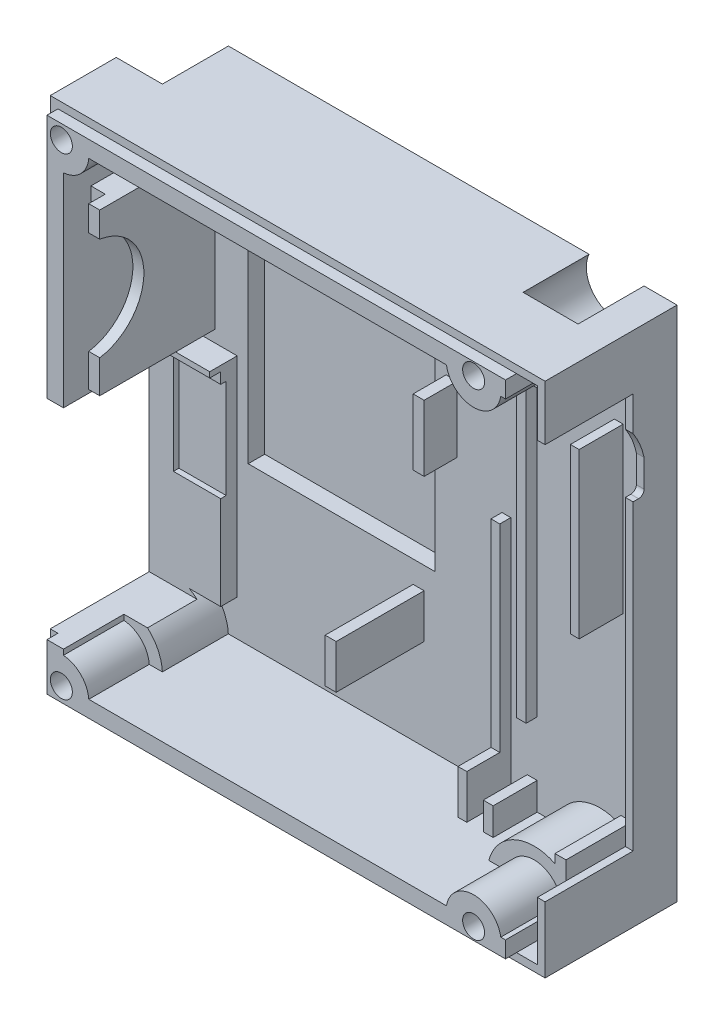
from build123d import *

# Parameters (mm, degrees)
SCHIZZO1_W                    = 45
SCHIZZO1_H                    = 47
ESTRUSIONE_ESTRUSIONE1_DEPTH  = 13
SCHIZZO2_W                    = 45
SCHIZZO2_H                    = 47
SCHIZZO2_W_2                  = 43.6
SCHIZZO2_H_2                  = 45.6
TAGLIO_ESTRUSIONE1_DEPTH      = 1
SCHIZZO3_W                    = 20
SCHIZZO3_H                    = 23
ESTRUSIONE_ESTRUSIONE2_DEPTH  = 1.5
SCHIZZO4_W                    = 5
SCHIZZO4_H                    = 16
TAGLIO_ESTRUSIONE2_DEPTH      = 1
SCHIZZO5_W                    = 5
SCHIZZO5_H                    = 7
TAGLIO_ESTRUSIONE3_DEPTH      = 1
TAGLIO_ESTRUSIONE4_DEPTH      = 6
TAGLIO_ESTRUSIONE7_DEPTH      = 34.38787205
TAGLIO_ESTRUSIONE7_DEPTH_BACK = 34.38787205
SCHIZZO7_R                    = 1
SVUOTA1_START                 = 1.5
SVUOTA1_DEPTH                 = 11.5
SVUOTA1_START_2               = 4
SVUOTA1_2_DEPTH               = 9
SVUOTA1_3_OUTLINE_W           = 17
SVUOTA1_3_OUTLINE_H           = 20
SVUOTA1_3_DEPTH               = 1.5
SVUOTA1_START_3               = 7.5
SVUOTA1_4_DEPTH               = 5.5
TAGLIO_ESTRUSIONE8_START      = -6.5
SCHIZZO8_W                    = 10
SCHIZZO8_H                    = 19
TAGLIO_ESTRUSIONE8_DEPTH      = 6.5
TAGLIO_ESTRUSIONE9_REACH      = 54.405
SCHIZZO9_W                    = 9
SCHIZZO9_H                    = 36
SCHIZZO10_W                   = 10
SCHIZZO10_H                   = 3
TAGLIO_ESTRUSIONE10_DEPTH     = 0.5
SCHIZZO11_W                   = 1
SCHIZZO11_H                   = 6
ESTRUSIONE_ESTRUSIONE3_DEPTH  = 3
SCHIZZO12_W                   = 1
SCHIZZO12_H                   = 4
ESTRUSIONE_ESTRUSIONE4_DEPTH  = 8
TAGLIO_ESTRUSIONE14_START     = -11.5
SCHIZZO15_W                   = 1.9
SCHIZZO15_H                   = 45.6
TAGLIO_ESTRUSIONE14_DEPTH     = 11.5
SCHIZZO13_W                   = 0.8
SCHIZZO13_H                   = 42.6
SCHIZZO13_W_2                 = 0.9
ESTRUSIONE_ESTRUSIONE5_DEPTH  = 4
TAGLIO_ESTRUSIONE15_DEPTH     = 1
TAGLIO_ESTRUSIONE16_DEPTH     = 1
SCHIZZO17_W                   = 4.3
SCHIZZO17_H                   = 9
TAGLIO_ESTRUSIONE17_DEPTH     = 0.5
SCHIZZO18_W                   = 1
SCHIZZO18_H                   = 1.5
SCHIZZO18_W_2                 = 0.8
SCHIZZO18_H_2                 = 14.918008703
ESTRUSIONE_ESTRUSIONE6_DEPTH  = 6
ESTRUSIONE_ESTRUSIONE7_DEPTH  = 10.5
TAGLIO_ESTRUSIONE18_REACH     = 38.478
SCHIZZO20_W                   = 1.3
SCHIZZO20_H                   = 1.5
TAGLIO_ESTRUSIONE19_DEPTH     = 1
TAGLIO_ESTRUSIONE20_REACH     = 54.405
TAGLIO_ESTRUSIONE21_REACH     = 51.516
SCHIZZO23_W                   = 2
SCHIZZO23_H                   = 14.918008703


# Read off the part's stored shape, not the designer's step: Svuota1
with BuildPart() as part:
    # Schizzo1 → Estrusione-Estrusione1 (new body)
    with BuildSketch(Plane.XY):
        Rectangle(SCHIZZO1_W, SCHIZZO1_H)
    extrude(amount=ESTRUSIONE_ESTRUSIONE1_DEPTH)

    # Schizzo2 → Taglio-Estrusione1 (cut)
    with BuildSketch(Plane.XY.offset(13)):
        Rectangle(SCHIZZO2_W, SCHIZZO2_H)
        Rectangle(SCHIZZO2_W_2, SCHIZZO2_H_2, mode=Mode.SUBTRACT)
    extrude(amount=-TAGLIO_ESTRUSIONE1_DEPTH, mode=Mode.SUBTRACT)

    # Schizzo3 → Estrusione-Estrusione2 (add)
    with BuildSketch(Plane(origin=(0, 0, 0), x_dir=(-1, 0, 0), z_dir=(0, 0, -1))):
        with Locations((6.5, 3)):
            Rectangle(SCHIZZO3_W, SCHIZZO3_H)
    extrude(amount=ESTRUSIONE_ESTRUSIONE2_DEPTH)

    # Schizzo4 → Taglio-Estrusione2 (cut)
    with BuildSketch(Plane(origin=(0, 0, 0), x_dir=(-1, 0, 0), z_dir=(0, 0, -1))):
        with Locations((20, -8.5)):
            Rectangle(SCHIZZO4_W, SCHIZZO4_H)
    extrude(amount=-TAGLIO_ESTRUSIONE2_DEPTH, mode=Mode.SUBTRACT)

    # Schizzo5 → Taglio-Estrusione3 (cut)
    with BuildSketch(Plane(origin=(0, 0, 1), x_dir=(-1, 0, 0), z_dir=(0, 0, -1))):
        with Locations((20, -13)):
            Rectangle(SCHIZZO5_W, SCHIZZO5_H)
    extrude(amount=-TAGLIO_ESTRUSIONE3_DEPTH, mode=Mode.SUBTRACT)

    # Schizzo6 → Taglio-Estrusione4 (cut)
    with BuildSketch(Plane(origin=(0, 0, 0), x_dir=(-1, 0, 0), z_dir=(0, 0, -1))):
        with BuildLine():
            Line((22.5, -23.5), (18.3, -23.5))
            Line((18.3, -23.5), (18.3, -21.5))
            ThreePointArc((18.3, -21.5), (19.032233047, -19.732233047), (20.8, -19))
            Line((20.8, -19), (22.5, -19))
            Line((22.5, -19), (22.5, -23.5))
        make_face()
        with BuildLine():
            Line((-14.5, -23.5), (-19.5, -23.5))
            ThreePointArc((-19.5, -23.5), (-17, -19.604356076), (-14.5, -23.5))
        make_face()
        with BuildLine():
            Line((22.5, 19), (20.8, 19))
            ThreePointArc((20.8, 19), (19.032233047, 19.732233047), (18.3, 21.5))
            Line((18.3, 21.5), (18.3, 23.5))
            Line((18.3, 23.5), (22.5, 23.5))
            Line((22.5, 23.5), (22.5, 19))
        make_face()
        with BuildLine():
            Line((-14.5, 23.5), (-19.5, 23.5))
            ThreePointArc((-19.5, 23.5), (-17, 19.604356076), (-14.5, 23.5))
        make_face()
    extrude(amount=-TAGLIO_ESTRUSIONE4_DEPTH, mode=Mode.SUBTRACT)

    # Schizzo7 → Taglio-Estrusione7 (cut, two sides: drawn at the far end of the back side and taken through both)
    with BuildSketch(Plane(origin=(0, 0, 6), x_dir=(-1, 0, 0), z_dir=(0, 0, -1)).offset(-TAGLIO_ESTRUSIONE7_DEPTH_BACK)):
        with Locations((20.49, -21.48)):
            Circle(SCHIZZO7_R)
        with Locations((-17, -21.69)):
            Circle(SCHIZZO7_R)
        with Locations((-17, 21.69)):
            Circle(SCHIZZO7_R)
        with Locations((20.49, 21.51)):
            Circle(SCHIZZO7_R)
    extrude(amount=TAGLIO_ESTRUSIONE7_DEPTH + TAGLIO_ESTRUSIONE7_DEPTH_BACK, mode=Mode.SUBTRACT)

    # Svuota1 outline → Svuota1 (cut)
    with BuildSketch(Plane.XY.offset(SVUOTA1_START)):
        with BuildLine():
            ThreePointArc((20.3, 19.676203728), (16.091095381, 18.202682631), (12.882861034, 21.3))
            Line((12.882861034, 21.3), (-16.805003129, 21.3))
            ThreePointArc((-16.805003129, 21.3), (-17.867102709, 18.78005267), (-20.3, 17.531373033))
            Line((-20.3, 17.531373033), (-20.3, 1))
            Line((-20.3, 1), (-16, 1))
            Line((-16, 1), (-16, -18))
            Line((-16, -18), (-18.863508327, -18))
            ThreePointArc((-18.863508327, -18), (-17.4061616, -19.382959398), (-16.805003129, -21.3))
            Line((-16.805003129, -21.3), (12.882861034, -21.3))
            ThreePointArc((12.882861034, -21.3), (16.091095381, -18.202682631), (20.3, -19.676203728))
            Line((20.3, -19.676203728), (20.3, 19.676203728))
        make_face()
    extrude(amount=SVUOTA1_DEPTH, mode=Mode.SUBTRACT)

    # Svuota1 2 outline → Svuota1 2 (cut)
    with BuildSketch(Plane.XY.offset(SVUOTA1_START_2)):
        with BuildLine():
            Line((-16, 1), (-20.3, 1))
            Line((-20.3, 1), (-20.3, -17.531373033))
            ThreePointArc((-20.3, -17.531373033), (-19.559425243, -17.697241228), (-18.863508327, -18))
            Line((-18.863508327, -18), (-16, -18))
            Line((-16, -18), (-16, 1))
        make_face()
    extrude(amount=SVUOTA1_2_DEPTH, mode=Mode.SUBTRACT)

    # Svuota1 3 outline → Svuota1 3 (cut)
    with BuildSketch(Plane.XY):
        with Locations((-6.5, 3)):
            Rectangle(SVUOTA1_3_OUTLINE_W, SVUOTA1_3_OUTLINE_H)
    extrude(amount=SVUOTA1_3_DEPTH, mode=Mode.SUBTRACT)

    # Svuota1 4 outline → Svuota1 4 (cut)
    with BuildSketch(Plane.XY.offset(SVUOTA1_START_3)):
        with BuildLine():
            ThreePointArc((19.469392638, 21.3), (17, 19.19), (14.530607362, 21.3))
            Line((14.530607362, 21.3), (12.882861034, 21.3))
            ThreePointArc((12.882861034, 21.3), (16.091095381, 18.202682631), (20.3, 19.676203728))
            Line((20.3, 19.676203728), (20.3, 21.3))
            Line((20.3, 21.3), (19.469392638, 21.3))
        make_face()
        with BuildLine():
            ThreePointArc((-20.3, 17.531373033), (-17.867102709, 18.78005267), (-16.805003129, 21.3))
            Line((-16.805003129, 21.3), (-17.998835614, 21.3))
            ThreePointArc((-17.998835614, 21.3), (-18.729341085, 19.735153476), (-20.3, 19.017230456))
            Line((-20.3, 19.017230456), (-20.3, 17.531373033))
        make_face()
        with BuildLine():
            Line((20.3, -21.3), (20.3, -19.676203728))
            ThreePointArc((20.3, -19.676203728), (16.091095381, -18.202682631), (12.882861034, -21.3))
            Line((12.882861034, -21.3), (14.530607362, -21.3))
            ThreePointArc((14.530607362, -21.3), (17, -19.19), (19.469392638, -21.3))
            Line((19.469392638, -21.3), (20.3, -21.3))
        make_face()
        with BuildLine():
            ThreePointArc((-16.805003129, -21.3), (-17.867102709, -18.78005267), (-20.3, -17.531373033))
            Line((-20.3, -17.531373033), (-20.3, -18.987230456))
            ThreePointArc((-20.3, -18.987230456), (-18.718691348, -19.715781856), (-17.99648842, -21.3))
            Line((-17.99648842, -21.3), (-16.805003129, -21.3))
        make_face()
    extrude(amount=SVUOTA1_4_DEPTH, mode=Mode.SUBTRACT)

    # Schizzo8 → Taglio-Estrusione8 (cut)
    with BuildSketch(Plane.ZY.offset(22.5).offset(TAGLIO_ESTRUSIONE8_START)):
        with Locations((8, -9)):
            Rectangle(SCHIZZO8_W, SCHIZZO8_H)
    extrude(amount=TAGLIO_ESTRUSIONE8_DEPTH, mode=Mode.SUBTRACT)

    # Schizzo9 → Taglio-Estrusione9 (cut, up to next)
    with BuildSketch(Plane(origin=(22.5, 0, 0), x_dir=(0, 0, -1), z_dir=(1, 0, 0)), mode=Mode.PRIVATE) as taglio_estrusione9_sk1:
        with Locations((-8.5, 0.5)):
            Rectangle(SCHIZZO9_W, SCHIZZO9_H)
    taglio_estrusione9_tool1 = extrude(taglio_estrusione9_sk1.sketch, amount=-TAGLIO_ESTRUSIONE9_REACH, mode=Mode.PRIVATE) & part.part
    add(taglio_estrusione9_tool1.solids().sort_by_distance((22.5, 0.5, 8.5))[0], mode=Mode.SUBTRACT)

    # Schizzo10 → Taglio-Estrusione10 (cut)
    with BuildSketch(Plane(origin=(0, 0, 0), x_dir=(-1, 0, 0), z_dir=(0, 0, -1))):
        with Locations((-11, -7)):
            Rectangle(SCHIZZO10_W, SCHIZZO10_H)
    extrude(amount=-TAGLIO_ESTRUSIONE10_DEPTH, mode=Mode.SUBTRACT)

    # Schizzo11 → Estrusione-Estrusione3 (add)
    with BuildSketch(Plane.XY.offset(1.5)):
        with Locations((3.5, 6)):
            Rectangle(SCHIZZO11_W, SCHIZZO11_H)
    extrude(amount=ESTRUSIONE_ESTRUSIONE3_DEPTH)

    # Schizzo12 → Estrusione-Estrusione4 (add)
    with BuildSketch(Plane.XY.offset(1.5)):
        with Locations((0.5, -11)):
            Rectangle(SCHIZZO12_W, SCHIZZO12_H)
    extrude(amount=ESTRUSIONE_ESTRUSIONE4_DEPTH)

    # Schizzo15 → Taglio-Estrusione14 (cut)
    with BuildSketch(Plane.XY.offset(13).offset(TAGLIO_ESTRUSIONE14_START)):
        with Locations((20.85, 0)):
            Rectangle(SCHIZZO15_W, SCHIZZO15_H)
    extrude(amount=TAGLIO_ESTRUSIONE14_DEPTH, mode=Mode.SUBTRACT)

    # Schizzo13 → Estrusione-Estrusione5 (add)
    with BuildSketch(Plane.XY.offset(1.5)):
        with Locations((8.478, 0)):
            Rectangle(SCHIZZO13_W, SCHIZZO13_H)
        with Locations((10.828, 0)):
            Rectangle(SCHIZZO13_W_2, SCHIZZO13_H)
    extrude(amount=ESTRUSIONE_ESTRUSIONE5_DEPTH)

    # Schizzo14 → Taglio-Estrusione15 (cut)
    with BuildSketch(Plane.ZY.offset(-8.078)):
        Polygon((5.5, 18.8), (5.5, -17.3), (2.5, -17.3), (2.5, 0.7), (1.5, 0.7), (1.5, 18.8), align=None)
    extrude(amount=-TAGLIO_ESTRUSIONE15_DEPTH, mode=Mode.SUBTRACT)

    # Schizzo16 → Taglio-Estrusione16 (cut)
    with BuildSketch(Plane(origin=(11.278, 0, 0), x_dir=(0, 0, -1), z_dir=(1, 0, 0))):
        Polygon((-5.5, -18.8), (-5.5, 18.8), (-1.5, 18.8), (-1.5, 13.8), (-2.5, 13.8), (-2.5, -13.8), (-1.5, -13.8), (-1.5, -18.8), align=None)
    extrude(amount=-TAGLIO_ESTRUSIONE16_DEPTH, mode=Mode.SUBTRACT)

    # Schizzo17 → Taglio-Estrusione17 (cut)
    with BuildSketch(Plane.XY.offset(3)):
        with Locations((-18.15, -5)):
            Rectangle(SCHIZZO17_W, SCHIZZO17_H)
    extrude(amount=-TAGLIO_ESTRUSIONE17_DEPTH, mode=Mode.SUBTRACT)

    # Schizzo18 → Estrusione-Estrusione6 (add)
    with BuildSketch(Plane.XY.offset(1.5)):
        with Locations((19.4, 18.4975088)):
            Rectangle(SCHIZZO18_W, SCHIZZO18_H)
        with Locations((18.7, 5.711495552)):
            Rectangle(SCHIZZO18_W_2, SCHIZZO18_H_2)
        with Locations((19.4, -18.4975088)):
            Rectangle(SCHIZZO18_W, SCHIZZO18_H)
    extrude(amount=ESTRUSIONE_ESTRUSIONE6_DEPTH)

    # Schizzo19 → Estrusione-Estrusione7 (add)
    with BuildSketch(Plane.XY.offset(1.5)):
        Polygon((-20.3, 2.1), (-18, 2.1), (-18, 16.731373033), (-20.3, 16.731373033), (-20.3, 15.531373033), (-19, 15.531373033), (-19, 3.1), (-20.3, 3.1), align=None)
    extrude(amount=ESTRUSIONE_ESTRUSIONE7_DEPTH)

    # Taglio-Estrusione18: up to this face of the body (flat: up to its plane)
    taglio_estrusione18_end = Plane(part.part.faces().sort_by_distance((-19.15, 16.731373033, 6.75))[0])
    # Schizzo20 → Taglio-Estrusione18 (cut, up to the picked face)
    with BuildSketch(Plane.XZ.offset(-2.1), mode=Mode.PRIVATE) as taglio_estrusione18_sk1:
        with Locations((-19.65, 11.25)):
            Rectangle(SCHIZZO20_W, SCHIZZO20_H)
    taglio_estrusione18_tool1 = split(extrude(taglio_estrusione18_sk1.sketch, amount=-TAGLIO_ESTRUSIONE18_REACH, mode=Mode.PRIVATE), bisect_by=taglio_estrusione18_end, keep=Keep.BOTH, mode=Mode.PRIVATE)
    add(taglio_estrusione18_tool1.solids().sort_by(Axis((-19.65, 2.1, 11.25), (0, 1, 0)))[0], mode=Mode.SUBTRACT)

    # Schizzo21 → Taglio-Estrusione19 (cut)
    with BuildSketch(Plane(origin=(-18, 0, 0), x_dir=(0, 0, -1), z_dir=(1, 0, 0))):
        with BuildLine():
            Line((-12, 14.431373033), (-12, 5.1))
            ThreePointArc((-12, 5.1), (-7.987002005, 9.765686517), (-12, 14.431373033))
        make_face()
    extrude(amount=-TAGLIO_ESTRUSIONE19_DEPTH, mode=Mode.SUBTRACT)

    # Schizzo22 → Taglio-Estrusione20 (cut, up to next)
    with BuildSketch(Plane(origin=(22.5, 0, 0), x_dir=(0, 0, -1), z_dir=(1, 0, 0)), mode=Mode.PRIVATE) as taglio_estrusione20_sk1:
        with BuildLine():
            Line((-3.5, 10), (-4, 10))
            Line((-4, 10), (-4, 15.37011378))
            ThreePointArc((-4, 15.37011378), (-3.38719978, 14.232649634), (-3, 13))
            Line((-3, 13), (-3, 10.5))
            ThreePointArc((-3, 10.5), (-3.146446609, 10.146446609), (-3.5, 10))
        make_face()
    taglio_estrusione20_tool1 = extrude(taglio_estrusione20_sk1.sketch, amount=-TAGLIO_ESTRUSIONE20_REACH, mode=Mode.PRIVATE) & part.part
    add(taglio_estrusione20_tool1.solids().sort_by_distance((22.5, 12.273213, 3.548102))[0], mode=Mode.SUBTRACT)

    # Schizzo23 → Taglio-Estrusione21 (cut, up to next)
    with BuildSketch(Plane(origin=(19.1, 0, 0), x_dir=(0, 0, -1), z_dir=(1, 0, 0)), mode=Mode.PRIVATE) as taglio_estrusione21_sk1:
        with Locations((-6.5, 5.711495552)):
            Rectangle(SCHIZZO23_W, SCHIZZO23_H)
    taglio_estrusione21_tool1 = extrude(taglio_estrusione21_sk1.sketch, amount=-TAGLIO_ESTRUSIONE21_REACH, mode=Mode.PRIVATE) & part.part
    add(taglio_estrusione21_tool1.solids().sort_by_distance((19.1, 5.711496, 6.5))[0], mode=Mode.SUBTRACT)


solid = part.part
